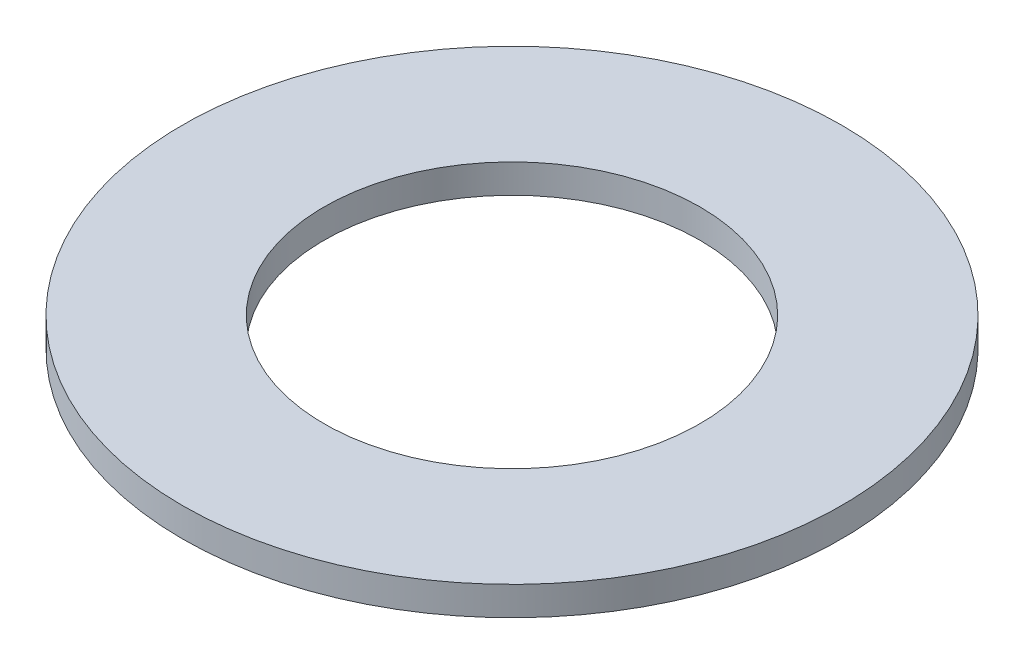
from build123d import *

# Parameters (mm, degrees)
SKETCH1_W = 24.5
SKETCH1_H = 5


with BuildPart() as part:
    # Sketch1 → Revolve1 (revolve)
    with BuildSketch(Plane.XY):
        with Locations((44.75, 0)):
            Rectangle(SKETCH1_W, SKETCH1_H)
    revolve(axis=Axis((0, 0, 0), (0, 1, 0)))


solid = part.part
